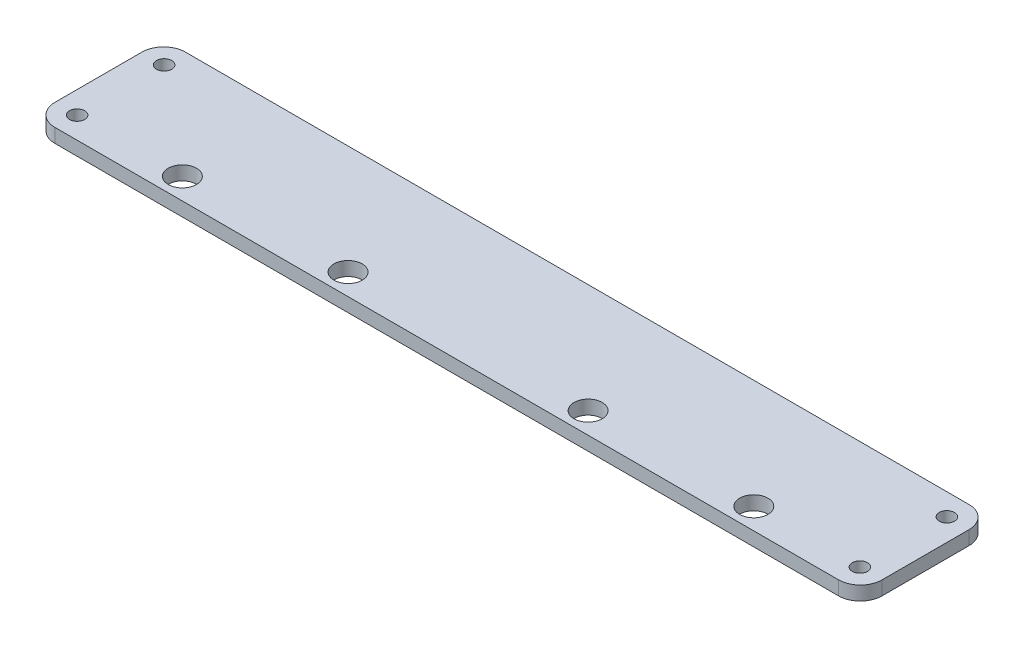
from build123d import *

# Parameters (mm, degrees)
SKETCH1_W           = 190.2
SKETCH1_H           = 30
BOSS_EXTRUDE1_DEPTH = 3.2
SKETCH2_R           = 1.75
CUT_EXTRUDE1_DEPTH  = 97.328863795
SKETCH3_R           = 3.25
CUT_EXTRUDE2_DEPTH  = 97.328863795
FILLET1_R           = 5


with BuildPart() as part:
    # Sketch1 → Boss-Extrude1 (new body)
    with BuildSketch(Plane(origin=(0, 0, 0), x_dir=(1, 0, 0), z_dir=(0, 1, 0))):
        Rectangle(SKETCH1_W, SKETCH1_H)
    extrude(amount=BOSS_EXTRUDE1_DEPTH)

    # Sketch2 → Cut-Extrude1 (cut, through all)
    with BuildSketch(Plane(origin=(0, 3.2, 0), x_dir=(1, 0, 0), z_dir=(0, 1, 0))):
        with Locations((-90, 10)):
            Circle(SKETCH2_R)
        with Locations((-90, -10)):
            Circle(SKETCH2_R)
        with Locations((90, 10)):
            Circle(SKETCH2_R)
        with Locations((90, -10)):
            Circle(SKETCH2_R)
    extrude(amount=-CUT_EXTRUDE1_DEPTH, mode=Mode.SUBTRACT)

    # Sketch3 → Cut-Extrude2 (cut, through all)
    with BuildSketch(Plane(origin=(0, 3.2, 0), x_dir=(1, 0, 0), z_dir=(0, 1, 0))):
        with Locations((65.7, -10.1)):
            Circle(SKETCH3_R)
        with Locations((27.6, -10.1)):
            Circle(SKETCH3_R)
        with Locations((-27.6, -10.1)):
            Circle(SKETCH3_R)
        with Locations((-65.7, -10.1)):
            Circle(SKETCH3_R)
    extrude(amount=-CUT_EXTRUDE2_DEPTH, mode=Mode.SUBTRACT)

    # Fillet1
    fillet1_edges = [part.edges().sort_by_distance(p)[0] for p in [
        (95.1, 1.6, 15),
        (95.1, 1.6, -15),
        (-95.1, 1.6, 15),
        (-95.1, 1.6, -15),
    ]]
    fillet(fillet1_edges, radius=FILLET1_R)


solid = part.part
